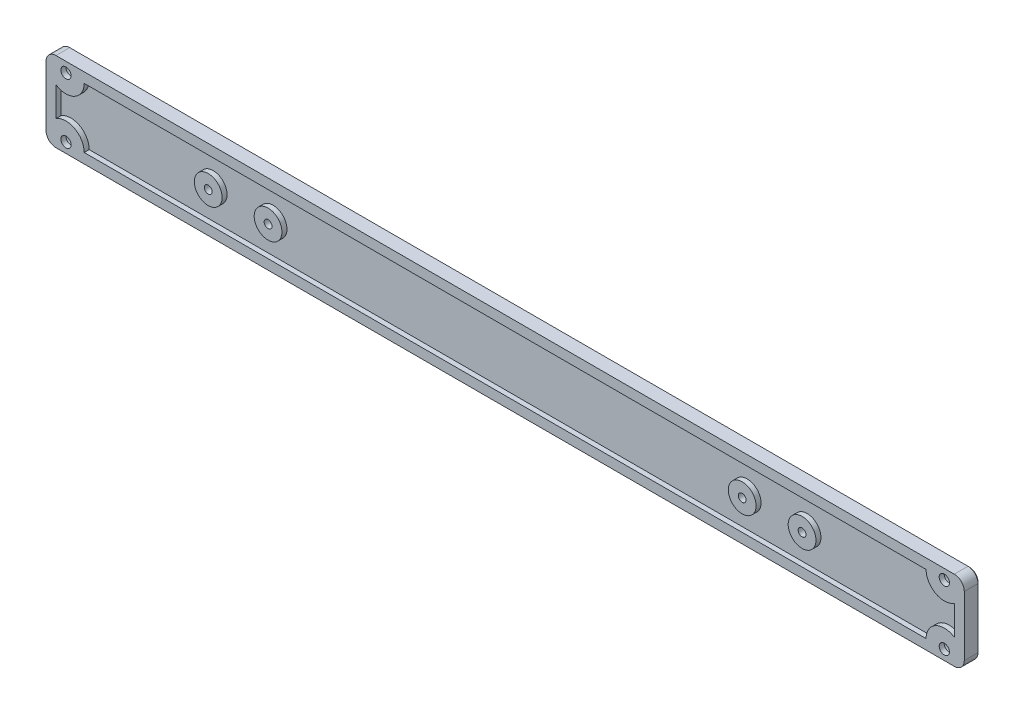
from build123d import *

# Parameters (mm, degrees)
SKETCH1_W           = 584.2
SKETCH1_H           = 50.8
BOSS_EXTRUDE1_DEPTH = 9.525
SKETCH2_R           = 3.2639
CUT_EXTRUDE2_DEPTH  = 1390.972066491
SKETCH3_R           = 5.23875
CUT_EXTRUDE3_DEPTH  = 6.35
FILLET1_R           = 6.35
SKETCH4_R           = 2.4892
CUT_EXTRUDE4_DEPTH  = 1390.972066491
CHAMFER1_SIZE       = 0.79375
SHELL1_START        = 6.35
SHELL1_OUTLINE_R    = 8.8392
SHELL1_DEPTH        = 3.175


# Read off the part's stored shape, not the designer's step: Shell1
with BuildPart() as part:
    # Sketch1 → Boss-Extrude1 (new body)
    with BuildSketch(Plane.XY):
        with Locations((0, 1333.5)):
            Rectangle(SKETCH1_W, SKETCH1_H)
    extrude(amount=BOSS_EXTRUDE1_DEPTH)

    # Sketch2 → Cut-Extrude2 (cut, through all)
    with BuildSketch(Plane.XY):
        with Locations(Location((279.4, 1314.45, 0), (0, 0, 180))):
            Circle(SKETCH2_R)
        with Locations(Location((279.4, 1352.55, 0), (0, 0, 180))):
            Circle(SKETCH2_R)
    cut_extrude2 = extrude(amount=CUT_EXTRUDE2_DEPTH, mode=Mode.SUBTRACT)

    # Sketch3 → Cut-Extrude3 (cut)
    with BuildSketch(Plane(origin=(0, 0, 0), x_dir=(-1, 0, 0), z_dir=(0, 0, -1))):
        with Locations((-279.4, 1314.45)):
            Circle(SKETCH3_R)
        with Locations((-279.4, 1352.55)):
            Circle(SKETCH3_R)
    cut_extrude3 = extrude(amount=-CUT_EXTRUDE3_DEPTH, mode=Mode.SUBTRACT)

    # Fillet1
    fillet1_edges = [part.edges().sort_by_distance(p)[0] for p in [
        (292.1, 1308.1, 4.7625),
        (-292.1, 1308.1, 4.7625),
        (-292.1, 1358.9, 4.7625),
        (292.1, 1358.9, 4.7625),
    ]]
    fillet(fillet1_edges, radius=FILLET1_R)

    # Sketch4 → Cut-Extrude4 (cut, symmetric)
    with BuildSketch(Plane.XY):
        with Locations((150.8125, 1333.5)):
            Circle(SKETCH4_R)
        with Locations((188.9125, 1333.5)):
            Circle(SKETCH4_R)
    cut_extrude4 = extrude(amount=CUT_EXTRUDE4_DEPTH, both=True, mode=Mode.SUBTRACT)

    # Mirror2: Cut-Extrude2, Cut-Extrude3, Cut-Extrude4 across plane
    add(cut_extrude2.mirror(Plane(origin=(0, 0, 0), x_dir=(0, 0, 1), z_dir=(1, 0, 0))), mode=Mode.SUBTRACT)
    add(cut_extrude3.mirror(Plane(origin=(0, 0, 0), x_dir=(0, 0, 1), z_dir=(1, 0, 0))), mode=Mode.SUBTRACT)
    add(cut_extrude4.mirror(Plane(origin=(0, 0, 0), x_dir=(0, 0, 1), z_dir=(1, 0, 0))), mode=Mode.SUBTRACT)

    # Chamfer1
    chamfer1_edges = [part.edges().sort_by_distance(p)[0] for p in [
        (0, 1308.1, 0),
        (292.1, 1333.5, 0),
        (-292.1, 1333.5, 0),
        (0, 1358.9, 0),
        (290.240128061, 1357.040128061, 0),
        (290.240128061, 1309.959871939, 0),
        (-290.240128061, 1357.040128061, 0),
        (-290.240128061, 1309.959871939, 0),
    ]]
    chamfer(chamfer1_edges, length=CHAMFER1_SIZE)

    # Shell1 outline → Shell1 (cut)
    with BuildSketch(Plane.XY.offset(SHELL1_START)):
        with BuildLine():
            Line((285.75, 1324.144154247), (285.75, 1342.855845753))
            ThreePointArc((285.75, 1342.855845753), (273.89043722, 1342.354714593), (267.81125, 1352.55))
            Line((267.81125, 1352.55), (-267.81125, 1352.55))
            ThreePointArc((-267.81125, 1352.55), (-273.89043722, 1342.354714593), (-285.75, 1342.855845753))
            Line((-285.75, 1342.855845753), (-285.75, 1324.144154247))
            ThreePointArc((-285.75, 1324.144154247), (-273.89043722, 1324.645285407), (-267.81125, 1314.45))
            Line((-267.81125, 1314.45), (267.81125, 1314.45))
            ThreePointArc((267.81125, 1314.45), (273.89043722, 1324.645285407), (285.75, 1324.144154247))
        make_face()
        with Locations((-188.9125, 1333.5)):
            Circle(SHELL1_OUTLINE_R, mode=Mode.SUBTRACT)
        with Locations((-150.8125, 1333.5)):
            Circle(SHELL1_OUTLINE_R, mode=Mode.SUBTRACT)
        with Locations((150.8125, 1333.5)):
            Circle(SHELL1_OUTLINE_R, mode=Mode.SUBTRACT)
        with Locations((188.9125, 1333.5)):
            Circle(SHELL1_OUTLINE_R, mode=Mode.SUBTRACT)
    extrude(amount=SHELL1_DEPTH, mode=Mode.SUBTRACT)


solid = part.part
